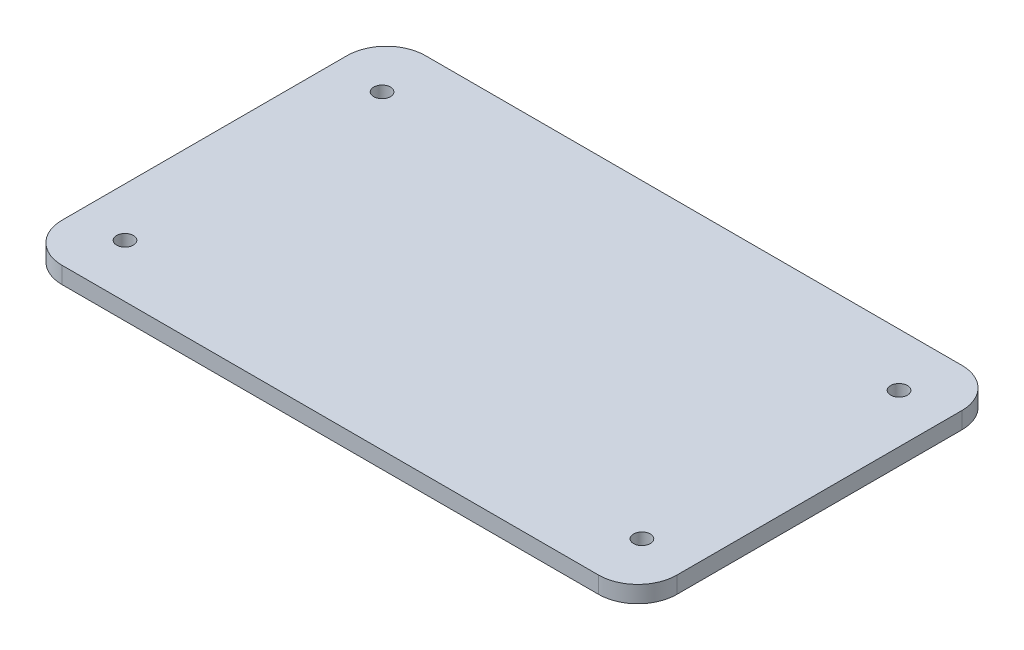
from build123d import *

# Parameters (mm, degrees)
SKETCH1_R           = 1.5
BOSS_EXTRUDE1_DEPTH = 1.5


with BuildPart() as part:
    # Sketch1 → Boss-Extrude1 (new, symmetric)
    with BuildSketch(Plane(origin=(0, 0, 0), x_dir=(1, 0, 0), z_dir=(0, 1, 0))):
        with BuildLine():
            Line((48, -32.5), (-48, -32.5))
            ThreePointArc((-48, -32.5), (-52.949747468, -30.449747468), (-55, -25.5))
            Line((-55, -25.5), (-55, 25.5))
            ThreePointArc((-55, 25.5), (-52.949747468, 30.449747468), (-48, 32.5))
            Line((-48, 32.5), (48, 32.5))
            ThreePointArc((48, 32.5), (52.949747468, 30.449747468), (55, 25.5))
            Line((55, 25.5), (55, -25.5))
            ThreePointArc((55, -25.5), (52.949747468, -30.449747468), (48, -32.5))
        make_face()
        with Locations((-46.25, 23)):
            Circle(SKETCH1_R, mode=Mode.SUBTRACT)
        with Locations((-46.25, -23)):
            Circle(SKETCH1_R, mode=Mode.SUBTRACT)
        with Locations((46.25, -23)):
            Circle(SKETCH1_R, mode=Mode.SUBTRACT)
        with Locations((46.25, 23)):
            Circle(SKETCH1_R, mode=Mode.SUBTRACT)
    extrude(amount=BOSS_EXTRUDE1_DEPTH, both=True)


solid = part.part
